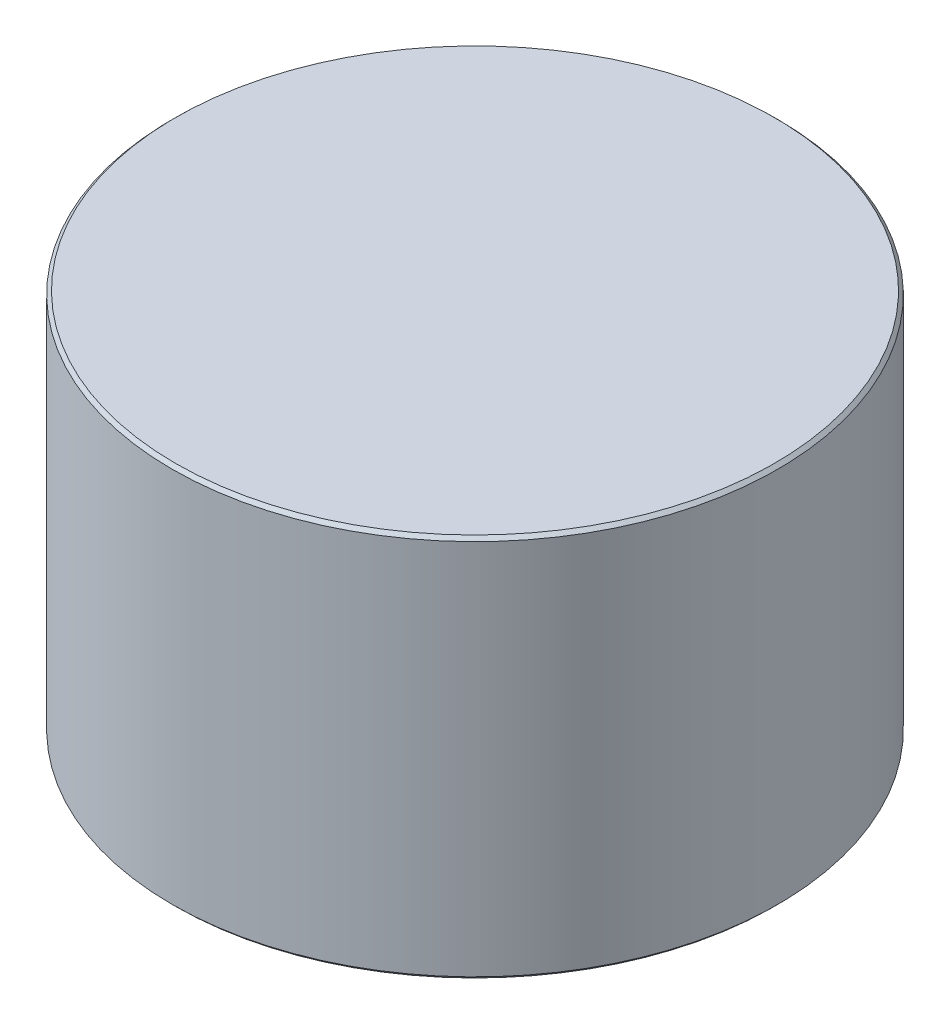
from build123d import *

# Parameters (mm, degrees)
MAIN_DIMENSIONS_SKETCH_R = 9
BODY_DEPTH               = 10
LIP_START                = -1.4
SKETCH1_3_R              = 9
SKETCH1_3_R_2            = 5.5
LIP_DEPTH                = 1.4
BREAK_EDGES_SIZE         = 0.1


with BuildPart() as part:
    # main_dimensions_sketch → body (new body)
    with BuildSketch(Plane(origin=(0, 0, 0), x_dir=(1, 0, 0), z_dir=(0, 1, 0))):
        Circle(MAIN_DIMENSIONS_SKETCH_R)
    extrude(amount=BODY_DEPTH)

    # Sketch1<3> → lip (add)
    with BuildSketch(Plane(origin=(0, 0, 0), x_dir=(1, 0, 0), z_dir=(0, 1, 0)).offset(LIP_START)):
        Circle(SKETCH1_3_R)
        Circle(SKETCH1_3_R_2, mode=Mode.SUBTRACT)
    extrude(amount=LIP_DEPTH)

    # break_edges
    break_edges_edges = [part.edges().sort_by_distance(p)[0] for p in [
        (-9, -1.4, 0),
        (-5.5, -1.4, 0),
        (-9, 10, 0),
    ]]
    chamfer(break_edges_edges, length=BREAK_EDGES_SIZE)


solid = part.part
